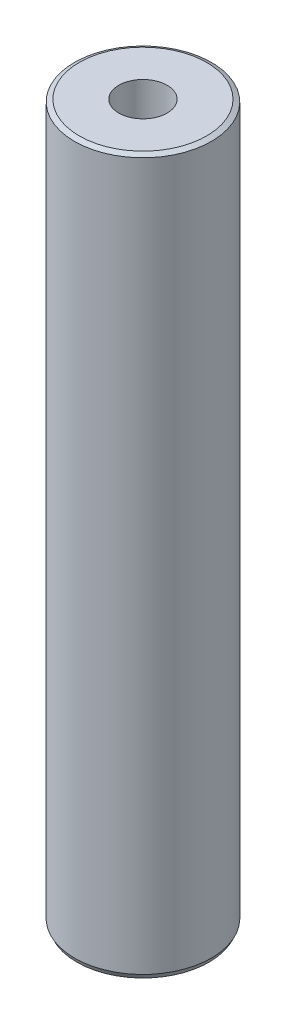
from build123d import *
from OCP.BRepFilletAPI import BRepFilletAPI_MakeChamfer

# Parameters (mm, degrees)
SKETCH1_R           = 57.5
BOSS_EXTRUDE1_DEPTH = 600
SKETCH2_R           = 20.29983283
CUT_EXTRUDE1_DEPTH  = 606.485342515
CHAMFER1_SIZE       = 1.984531436
CHAMFER1_SIZE2      = 3.998681031


with BuildPart() as part:
    # Sketch1 → Boss-Extrude1 (new body)
    with BuildSketch(Plane(origin=(0, 0, 0), x_dir=(1, 0, 0), z_dir=(0, 1, 0))):
        Circle(SKETCH1_R)
    extrude(amount=BOSS_EXTRUDE1_DEPTH)

    # Sketch2 → Cut-Extrude1 (cut, through all)
    with BuildSketch(Plane(origin=(0, 0, 0), x_dir=(1, 0, 0), z_dir=(0, 1, 0))):
        Circle(SKETCH2_R)
    extrude(amount=CUT_EXTRUDE1_DEPTH, mode=Mode.SUBTRACT)

    # Chamfer1: one chamfer whose edges measure the first distance from different faces: ONE call of the kernel's chamfer builder (chamfer() names one face for all edges)
    chamfer1_edges_1 = [part.edges().sort_by_distance(p)[0] for p in [
        (-57.5, 600, 0),
    ]]
    chamfer1_side_1 = [part.faces().sort_by_distance(p)[0] for p in [
        (-57.5, 300, 0),
    ]]
    chamfer1_edges_2 = [part.edges().sort_by_distance(p)[0] for p in [
        (-57.5, 0, 0),
    ]]
    chamfer1_side_2 = [part.faces().sort_by_distance(p)[0] for p in [
        (-55.873654403, 0, 0),
    ]]
    chamfer1 = BRepFilletAPI_MakeChamfer(part.part.solid().wrapped)
    for e in chamfer1_edges_1:
        chamfer1.Add(CHAMFER1_SIZE, CHAMFER1_SIZE2, e.wrapped, chamfer1_side_1[0].wrapped)  # the first distance lies on this face
    for e in chamfer1_edges_2:
        chamfer1.Add(CHAMFER1_SIZE, CHAMFER1_SIZE2, e.wrapped, chamfer1_side_2[0].wrapped)  # the first distance lies on this face
    add(Compound.cast(chamfer1.Shape()), mode=Mode.REPLACE)


solid = part.part
